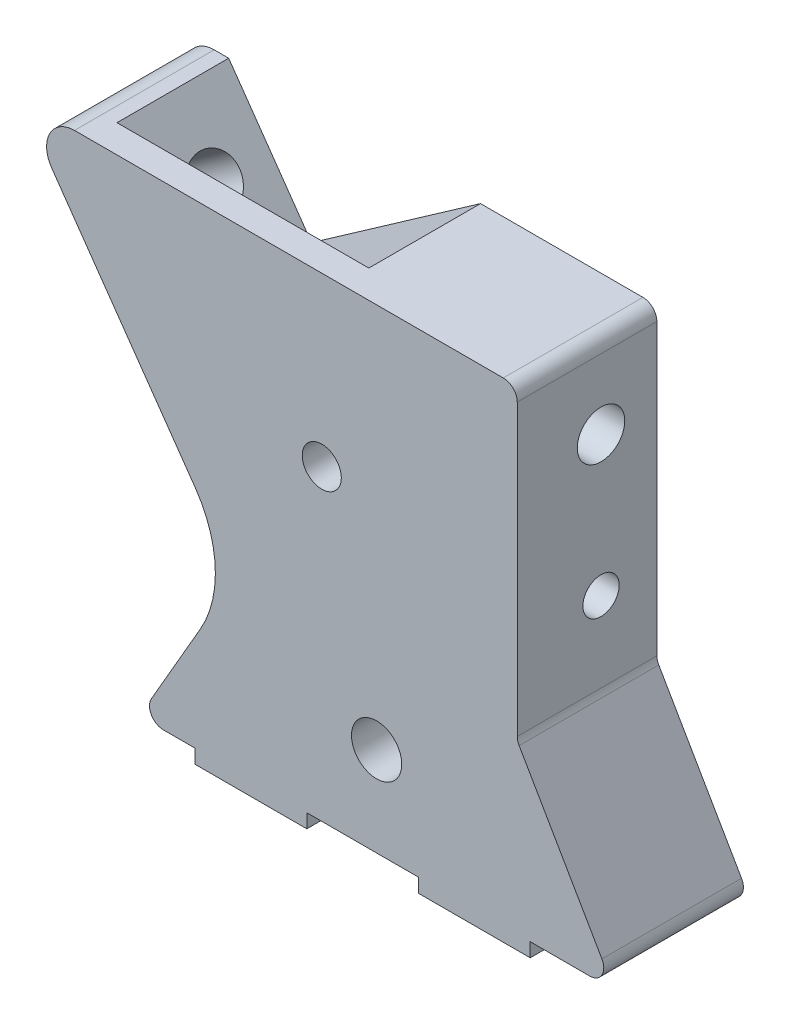
from build123d import *

# Parameters (mm, degrees)
BOSS_EXTRUDE1_DEPTH = 25
SKETCH5_R           = 3.25
SKETCH5_R_2         = 4.25
CUT_EXTRUDE2_DEPTH  = 15
SKETCH6_R           = 4.5
CUT_EXTRUDE3_DEPTH  = 93.883645912
CUT_EXTRUDE4_DEPTH  = 20
SKETCH8_W           = 20
SKETCH8_H           = 25
BOSS_EXTRUDE2_DEPTH = 2.5
SKETCH10_R          = 8.75
BOSS_EXTRUDE6_DEPTH = 5
SKETCH3_R           = 3.5
SKETCH3_R_2         = 4.5
CUT_EXTRUDE5_DEPTH  = 123.780291578
FILLET1_R           = 5
FILLET2_R           = 2.5


with BuildPart() as part:
    # Sketch1 → Boss-Extrude1 (new body)
    with BuildSketch(Plane.XY):
        with BuildLine():
            Line((0, 0), (85, 0))
            Line((85, 0), (67.679491924, 30))
            Line((67.679491924, 30), (67.679491924, 85))
            Line((67.679491924, 85), (-21.190906526, 85))
            Line((-21.190906526, 85), (10.012338278, 40.43714813))
            ThreePointArc((10.012338278, 40.43714813), (13.610261824, 29.83800715), (10.949805468, 18.965619403))
            Line((10.949805468, 18.965619403), (0, 0))
        make_face()
    extrude(amount=-BOSS_EXTRUDE1_DEPTH)

    # Sketch5 → Cut-Extrude2 (cut)
    with BuildSketch(Plane(origin=(67.679491924, 0, 0), x_dir=(0, 0, -1), z_dir=(1, 0, 0))):
        with Locations((15, 45)):
            Circle(SKETCH5_R)
        with Locations((15, 70)):
            Circle(SKETCH5_R_2)
    extrude(amount=-CUT_EXTRUDE2_DEPTH, mode=Mode.SUBTRACT)

    # Sketch6 → Cut-Extrude3 (cut, through all)
    with BuildSketch(Plane(origin=(25.717624677, 18.007674664, 0), x_dir=(0, 0, 1), z_dir=(-0.8191520442889889, -0.5735764363510502, 0))):
        with Locations((-15, 61.782528413)):
            Circle(SKETCH6_R)
    extrude(amount=-CUT_EXTRUDE3_DEPTH, mode=Mode.SUBTRACT)

    # Sketch7 → Cut-Extrude4 (cut)
    with BuildSketch(Plane(origin=(0, 0, -25), x_dir=(-1, 0, 0), z_dir=(0, 0, -1))):
        Polygon((-57.679491924, 80), (-57.679491924, 32.5), (-21.673862174, 32.5), (-4.621853415, 56.85279232), (-37.679491924, 80), align=None)
        Polygon((-63.349364905, 27.5), (-76.339745962, 5), (-8.660254038, 5), (-21.650635095, 27.5), align=None)
        Polygon((-36.10299798, 85), (-5.849731455, 63.816434723), (8.983160638, 85), align=None)
    extrude(amount=-CUT_EXTRUDE4_DEPTH, mode=Mode.SUBTRACT)

    # Sketch8 → Boss-Extrude2 (add)
    with BuildSketch(Plane.XZ):
        with Locations((60, -12.5)):
            Rectangle(SKETCH8_W, SKETCH8_H)
        with Locations((20, -12.5)):
            Rectangle(SKETCH8_W, SKETCH8_H)
    extrude(amount=BOSS_EXTRUDE2_DEPTH)

    # Sketch10 → Boss-Extrude6 (add)
    with BuildSketch(Plane(origin=(0, 0, -5), x_dir=(-1, 0, 0), z_dir=(0, 0, -1))):
        with Locations((-32.679491924, 55)):
            Circle(SKETCH10_R)
        with Locations((-42.5, 16)):
            Circle(SKETCH10_R)
    extrude(amount=BOSS_EXTRUDE6_DEPTH)

    # Sketch3 → Cut-Extrude5 (cut, through all)
    with BuildSketch(Plane.XY):
        with Locations((32.679491924, 55)):
            Circle(SKETCH3_R)
        with Locations((42.5, 16)):
            Circle(SKETCH3_R_2)
    extrude(amount=-CUT_EXTRUDE5_DEPTH, mode=Mode.SUBTRACT)

    # Fillet1
    fillet1_edges = [part.edges().sort_by_distance(p)[0] for p in [
        (-21.190906526, 85, -12.5),
    ]]
    fillet(fillet1_edges, radius=FILLET1_R)

    # Fillet2
    fillet2_edges = [part.edges().sort_by_distance(p)[0] for p in [
        (0, 0, -12.5),
        (67.679491924, 30, -12.5),
        (85, 0, -12.5),
        (67.679491924, 85, -12.5),
    ]]
    fillet(fillet2_edges, radius=FILLET2_R)


solid = part.part
